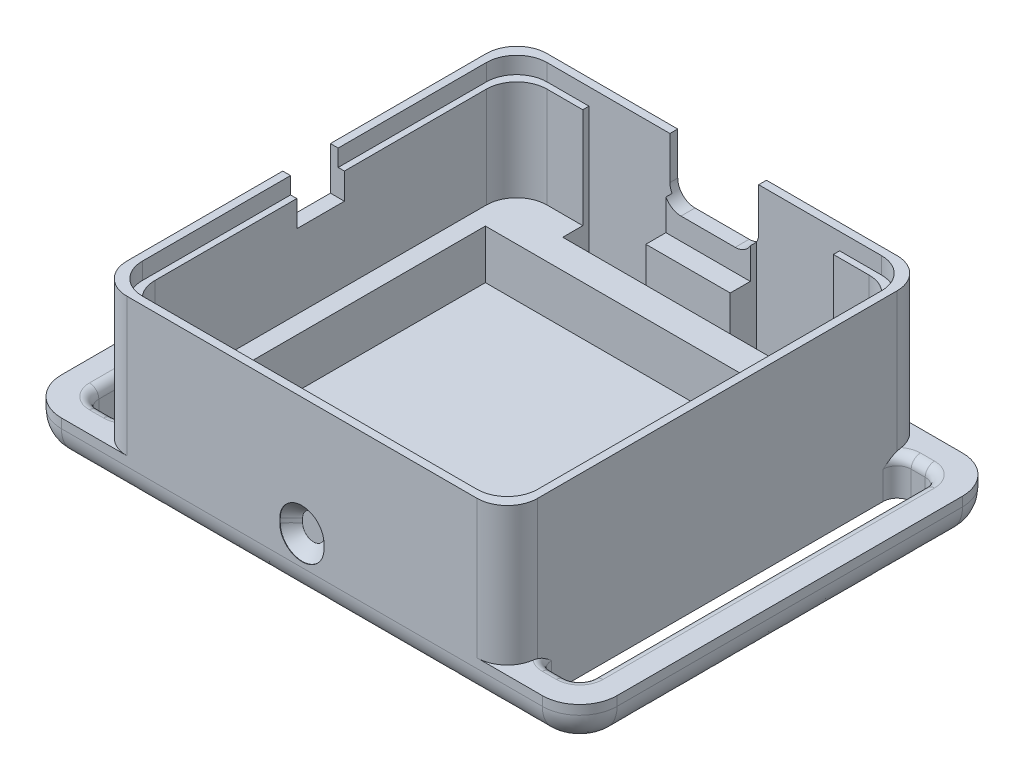
from build123d import *

# Parameters (mm, degrees)
BOTTOM_BASE_SKETCH_W                          = 44
BOTTOM_BASE_SKETCH_H                          = 45
BOTTOM_BASE_DEPTH                             = 1
SIDE_WALLS_SKETCH_W                           = 44
SIDE_WALLS_SKETCH_H                           = 45
SIDE_WALLS_SKETCH_W_2                         = 41
SIDE_WALLS_SKETCH_H_2                         = 42
SIDE_WALLS_DEPTH                              = 17.8
TOP_START                                     = -1.8
TOP_PLATE_SHOULDER_SKETCH_W                   = 42.333333334
TOP_PLATE_SHOULDER_SKETCH_H                   = 43.333333334
TOP_PLATE_SHOULDER_SKETCH_W_2                 = 41
TOP_PLATE_SHOULDER_SKETCH_H_2                 = 42
TOP_PLATE_SHOULDER_DEPTH                      = 1.8
STRAP_BRACKET_DEPTH                           = 4
CASE_FILLET_R                                 = 3.25
INNER_STRAP_BRACKET_FILLETS_R                 = 1.5
OUTER_STRAP_BRACKET_FILLETS_R                 = 4
USB_PORT_HOLE_REACH                           = 59.127
SWITCH_HOLE_REACH                             = 61.479
SWITCH_HOLE_SKETCH_W                          = 5.1
SWITCH_HOLE_SKETCH_H                          = 4.6
BATTERY_START                                 = 5.25
BATTERY_COMPARTMENT_SKETCH_W                  = 37.2
BATTERY_COMPARTMENT_SKETCH_H                  = 31.5
BATTERY_COMPARTMENT_DEPTH                     = 5.25
COMFORT_FILLET_SIZE                           = 2.5
COMFORT_FILLET_SIZE_2                         = 3
STRAP_FILLET_R                                = 1
CLIP_HOLE_SKETCH_W                            = 8.9
CLIP_HOLE_SKETCH_H                            = 2.813566806
CLIP_HOLE_DEPTH                               = 42.770234788
CLIP_HOLDER_DEPTH                             = 8.9
CLIP_MIRROR_AT_THE_SECOND_PLANE_COPY_1_S_W    = 8.9
CLIP_MIRROR_AT_THE_SECOND_PLANE_COPY_1_S_H    = 2.813566806
CLIP_MIRROR_AT_THE_SECOND_PLANE_COPY_1_DEPTH  = 42.770234788
CLIP_MIRROR_AT_THE_SECOND_PLANE_COPY_2_DEPTH  = 8.9
MIDDLE_REINFORCEMENT_SKETCH_W                 = 9.04
MIDDLE_REINFORCEMENT_SKETCH_H                 = 2.146900139
MIDDLE_REINFORCEMENT_DEPTH                    = 3.8
CLIP_BUTTON_HOLE_DEPTH                        = 1.25
CLIP_BUTTON_HOLE_FILLET_SIZE                  = 1.2
CLIP_BUTTON_HOLE_FILLET_OF_CLIP_BUTTON_H_SIZE = 1.2


with BuildPart() as part:
    # Bottom base Sketch → Bottom base (new body)
    with BuildSketch(Plane(origin=(0, 0, 0), x_dir=(1, 0, 0), z_dir=(0, 1, 0))):
        Rectangle(BOTTOM_BASE_SKETCH_W, BOTTOM_BASE_SKETCH_H)
    extrude(amount=BOTTOM_BASE_DEPTH)

    # Side walls sketch → Side walls (add)
    with BuildSketch(Plane(origin=(0, 1, 0), x_dir=(1, 0, 0), z_dir=(0, 1, 0))):
        Rectangle(SIDE_WALLS_SKETCH_W, SIDE_WALLS_SKETCH_H)
        Rectangle(SIDE_WALLS_SKETCH_W_2, SIDE_WALLS_SKETCH_H_2, mode=Mode.SUBTRACT)
    extrude(amount=SIDE_WALLS_DEPTH)

    # Top plate shoulder sketch → Top plate shoulder (cut)
    with BuildSketch(Plane(origin=(0, 18.8, 0), x_dir=(1, 0, 0), z_dir=(0, 1, 0)).offset(TOP_START)):
        Rectangle(TOP_PLATE_SHOULDER_SKETCH_W, TOP_PLATE_SHOULDER_SKETCH_H)
        Rectangle(TOP_PLATE_SHOULDER_SKETCH_W_2, TOP_PLATE_SHOULDER_SKETCH_H_2, mode=Mode.SUBTRACT)
    extrude(amount=TOP_PLATE_SHOULDER_DEPTH, mode=Mode.SUBTRACT)

    # Strap Bracket Sketch → Strap Bracket (add)
    with BuildSketch(Plane.XZ):
        Polygon((22, -19.25), (22, -22.5), (29.75, -22.5), (29.75, 22.5), (22, 22.5), (22, 19.25), (26.5, 19.25), (26.5, -19.25), align=None)
        Polygon((-29.75, 22.5), (-29.75, -22.5), (-22, -22.5), (-22, -19.25), (-26.5, -19.25), (-26.5, 19.25), (-22, 19.25), (-22, 22.5), align=None)
    extrude(amount=-STRAP_BRACKET_DEPTH)

    # Case fillet
    case_fillet_edges = [part.edges().sort_by_distance(p)[0] for p in [
        (22, 11.4, 22.5),
        (-22, 11.4, 22.5),
        (21.166666667, 17.9, 21.666666667),
        (-21.166666667, 17.9, 21.666666667),
        (-20.5, 9, 21),
        (20.5, 9, 21),
        (-21.166666667, 17.9, -21.666666667),
        (-20.5, 9, -21),
        (-22, 11.4, -22.5),
        (21.166666667, 17.9, -21.666666667),
        (20.5, 9, -21),
        (22, 11.4, -22.5),
    ]]
    fillet(case_fillet_edges, radius=CASE_FILLET_R)

    # Inner Strap Bracket Fillets
    inner_strap_bracket_fillets_edges = [part.edges().sort_by_distance(p)[0] for p in [
        (22, 2, 19.25),
        (22, 2, -19.25),
        (26.5, 2, -19.25),
        (26.5, 2, 19.25),
        (-26.5, 2, 19.25),
        (-26.5, 2, -19.25),
        (-22, 2, -19.25),
        (-22, 2, 19.25),
    ]]
    fillet(inner_strap_bracket_fillets_edges, radius=INNER_STRAP_BRACKET_FILLETS_R)

    # Outer Strap Bracket Fillets
    outer_strap_bracket_fillets_edges = [part.edges().sort_by_distance(p)[0] for p in [
        (29.75, 2, 22.5),
        (29.75, 2, -22.5),
        (-29.75, 2, -22.5),
        (-29.75, 2, 22.5),
    ]]
    fillet(outer_strap_bracket_fillets_edges, radius=OUTER_STRAP_BRACKET_FILLETS_R)

    # USB Port Hole: up to this face of the body (flat: up to its plane)
    usb_port_hole_end = Plane(part.part.faces().sort_by_distance((0, 9, -21))[0])
    # USB Port Hole Sketch → USB Port Hole (cut, up to the picked face)
    with BuildSketch(Plane(origin=(0, 0, -22.5), x_dir=(-1, 0, 0), z_dir=(0, 0, -1)), mode=Mode.PRIVATE) as usb_port_hole_sk1:
        with BuildLine():
            Line((-4.75, 18.8), (-4.75, 14.25))
            ThreePointArc((-4.75, 14.25), (-4.208147545, 12.941852455), (-2.9, 12.4))
            Line((-2.9, 12.4), (2.9, 12.4))
            ThreePointArc((2.9, 12.4), (4.208147545, 12.941852455), (4.75, 14.25))
            Line((4.75, 14.25), (4.75, 18.8))
            Line((4.75, 18.8), (-4.75, 18.8))
        make_face()
    usb_port_hole_tool1 = split(extrude(usb_port_hole_sk1.sketch, amount=-USB_PORT_HOLE_REACH, mode=Mode.PRIVATE), bisect_by=usb_port_hole_end, keep=Keep.BOTH, mode=Mode.PRIVATE)
    add(usb_port_hole_tool1.solids().sort_by(Axis((0, 15.668996, -22.5), (0, 0, 1)))[0], mode=Mode.SUBTRACT)

    # Switch Hole: up to this face of the body (flat: up to its plane)
    switch_hole_end = Plane(part.part.faces().sort_by_distance((-20.5, 9, 0))[0])
    # Switch Hole Sketch → Switch Hole (cut, up to the picked face)
    with BuildSketch(Plane.ZY.offset(22), mode=Mode.PRIVATE) as switch_hole_sk1:
        with Locations((0, 16.5)):
            Rectangle(SWITCH_HOLE_SKETCH_W, SWITCH_HOLE_SKETCH_H)
    switch_hole_tool1 = split(extrude(switch_hole_sk1.sketch, amount=-SWITCH_HOLE_REACH, mode=Mode.PRIVATE), bisect_by=switch_hole_end, keep=Keep.BOTH, mode=Mode.PRIVATE)
    add(switch_hole_tool1.solids().sort_by(Axis((-22, 16.5, 0), (1, 0, 0)))[0], mode=Mode.SUBTRACT)

    # Battery Compartment sketch → Battery Compartment (add)
    with BuildSketch(Plane(origin=(0, 1, 0), x_dir=(1, 0, 0), z_dir=(0, 1, 0)).offset(BATTERY_START)):
        with BuildLine():
            Line((-20.5, 17.75), (-20.5, -17.75))
            ThreePointArc((-20.5, -17.75), (-19.548097039, -20.048097039), (-17.25, -21))
            Line((-17.25, -21), (17.25, -21))
            ThreePointArc((17.25, -21), (19.548097039, -20.048097039), (20.5, -17.75))
            Line((20.5, -17.75), (20.5, 17.75))
            ThreePointArc((20.5, 17.75), (19.548097039, 20.048097039), (17.25, 21))
            Line((17.25, 21), (-17.25, 21))
            ThreePointArc((-17.25, 21), (-19.548097039, 20.048097039), (-20.5, 17.75))
        make_face()
        Rectangle(BATTERY_COMPARTMENT_SKETCH_W, BATTERY_COMPARTMENT_SKETCH_H, mode=Mode.SUBTRACT)
    extrude(amount=-BATTERY_COMPARTMENT_DEPTH)

    # Comfort Fillet
    # a fillet whose section is not a circle: 3, 2.5 mm, written as the material it takes off along each edge
    with BuildSketch(Plane(origin=(25.75, 0, -18.5), x_dir=(0, 0, -1), z_dir=(-1, 0, 0))) as comfort_fillet_piece_1:
        with BuildLine():
            Bezier((4 - COMFORT_FILLET_SIZE, 0), (4, 0), (4, -COMFORT_FILLET_SIZE_2), weights=[1, 0.707106781, 1])
            Line((4, -COMFORT_FILLET_SIZE_2), (4, 0))
            Line((4, 0), (4 - COMFORT_FILLET_SIZE, 0))
        make_face()
    revolve(axis=Axis((25.75, 0, -18.5), (0, -1, 0)), revolution_arc=90, mode=Mode.SUBTRACT)
    with BuildSketch(Plane(origin=(29.75, 0, -18.5), x_dir=(-1, 0, 0), z_dir=(0, 0, 1)), Plane(origin=(-29.75, 0, 18.5), x_dir=(1, 0, 0), z_dir=(0, 0, -1))) as comfort_fillet_piece_2:
        with BuildLine():
            Bezier((COMFORT_FILLET_SIZE, 0), (0, 0), (0, -COMFORT_FILLET_SIZE_2), weights=[1, 0.707106781, 1])
            Line((0, -COMFORT_FILLET_SIZE_2), (0, 0))
            Line((0, 0), (COMFORT_FILLET_SIZE, 0))
        make_face()
    extrude(amount=37, mode=Mode.SUBTRACT)
    with BuildSketch(Plane(origin=(25.75, 0, 18.5), x_dir=(1, 0, 0), z_dir=(0, 0, -1))) as comfort_fillet_piece_3:
        with BuildLine():
            Bezier((4 - COMFORT_FILLET_SIZE, 0), (4, 0), (4, -COMFORT_FILLET_SIZE_2), weights=[1, 0.707106781, 1])
            Line((4, -COMFORT_FILLET_SIZE_2), (4, 0))
            Line((4, 0), (4 - COMFORT_FILLET_SIZE, 0))
        make_face()
    revolve(axis=Axis((25.75, 0, 18.5), (0, -1, 0)), revolution_arc=90, mode=Mode.SUBTRACT)
    with BuildSketch(Plane(origin=(25.75, 0, 22.5), x_dir=(0, 0, -1), z_dir=(-1, 0, 0))) as comfort_fillet_piece_4:
        with BuildLine():
            Bezier((COMFORT_FILLET_SIZE, 0), (0, 0), (0, -COMFORT_FILLET_SIZE_2), weights=[1, 0.707106781, 1])
            Line((0, -COMFORT_FILLET_SIZE_2), (0, 0))
            Line((0, 0), (COMFORT_FILLET_SIZE, 0))
        make_face()
    extrude(amount=51.5, mode=Mode.SUBTRACT)
    with BuildSketch(Plane(origin=(-25.75, 0, 18.5), x_dir=(0, 0, 1), z_dir=(1, 0, 0))) as comfort_fillet_piece_5:
        with BuildLine():
            Bezier((4 - COMFORT_FILLET_SIZE, 0), (4, 0), (4, -COMFORT_FILLET_SIZE_2), weights=[1, 0.707106781, 1])
            Line((4, -COMFORT_FILLET_SIZE_2), (4, 0))
            Line((4, 0), (4 - COMFORT_FILLET_SIZE, 0))
        make_face()
    revolve(axis=Axis((-25.75, 0, 18.5), (0, -1, 0)), revolution_arc=90, mode=Mode.SUBTRACT)
    with BuildSketch(Plane(origin=(-25.75, 0, -18.5), x_dir=(0, 0, -1), z_dir=(1, 0, 0))) as comfort_fillet_piece_6:
        with BuildLine():
            Bezier((4 - COMFORT_FILLET_SIZE, 0), (4, 0), (4, COMFORT_FILLET_SIZE_2), weights=[1, 0.707106781, 1])
            Line((4, COMFORT_FILLET_SIZE_2), (4, 0))
            Line((4, 0), (4 - COMFORT_FILLET_SIZE, 0))
        make_face()
    revolve(axis=Axis((-25.75, 0, -18.5), (0, 1, 0)), revolution_arc=90, mode=Mode.SUBTRACT)
    with BuildSketch(Plane(origin=(25.75, 0, -22.5), x_dir=(0, 0, 1), z_dir=(-1, 0, 0))) as comfort_fillet_piece_7:
        with BuildLine():
            Bezier((COMFORT_FILLET_SIZE, 0), (0, 0), (0, COMFORT_FILLET_SIZE_2), weights=[1, 0.707106781, 1])
            Line((0, COMFORT_FILLET_SIZE_2), (0, 0))
            Line((0, 0), (COMFORT_FILLET_SIZE, 0))
        make_face()
    extrude(amount=51.5, mode=Mode.SUBTRACT)

    # Strap Fillet
    # the kernel refuses this fillet: 1 mm, written as the material it takes off along each edge
    with BuildSketch(Plane(origin=(-23.5, 4, 17.75), x_dir=(-0.09638996566753387, 0, -0.9953436464450918), z_dir=(-0.9953436464450918, 0, 0.09638996566753387))) as strap_fillet_piece_1_section:
        with BuildLine():
            CenterArc((1.5 + STRAP_FILLET_R, STRAP_FILLET_R), STRAP_FILLET_R, 180, 90)
            Line((1.5 + STRAP_FILLET_R, 0), (1.5, 0))
            Line((1.5, 0), (1.5, STRAP_FILLET_R))
        make_face()
    strap_fillet_piece_1 = revolve(axis=Axis((-23.5, 4, 17.75), (0, -1, 0)), revolution_arc=185.531326158, mode=Mode.PRIVATE)
    strap_fillet_piece_1 = split(strap_fillet_piece_1, bisect_by=Plane(origin=(-22, 4, 17.75), z_dir=(-1, 0, 0)), keep=Keep.TOP, mode=Mode.PRIVATE)
    add(strap_fillet_piece_1, mode=Mode.SUBTRACT)
    with BuildSketch(Plane(origin=(-23.5, 4, 17.75), x_dir=(-0.09638996566753387, 0, -0.9953436464450918), z_dir=(-0.9953436464450918, 0, 0.09638996566753387))) as strap_fillet_piece_2_section:
        with BuildLine():
            CenterArc((1.5 + STRAP_FILLET_R, STRAP_FILLET_R), STRAP_FILLET_R, 180, 90)
            Line((1.5 + STRAP_FILLET_R, 0), (1.5, 0))
            Line((1.5, 0), (1.5, STRAP_FILLET_R))
        make_face()
    strap_fillet_piece_2 = revolve(axis=Axis((-23.5, 4, 17.75), (0, -1, 0)), revolution_arc=185.531326158, mode=Mode.PRIVATE)
    strap_fillet_piece_2 = split(strap_fillet_piece_2, bisect_by=Plane(origin=(-23.5, 4, 19.25), z_dir=(0, 0, 1)), keep=Keep.TOP, mode=Mode.PRIVATE)
    strap_fillet_piece_2 = strap_fillet_piece_2 - Plane(origin=(-18.75, 4, 19.25), x_dir=(0, 0, 1), z_dir=(0, 1, 0)) * Cylinder(3.25, 10, mode=Mode.PRIVATE)
    add(strap_fillet_piece_2, mode=Mode.SUBTRACT)
    with BuildSketch(Plane(origin=(-25, 4, 19.25), x_dir=(0, -1, 0), z_dir=(1, 0, 0)), Plane(origin=(-23.5, 4, -19.25), x_dir=(0, -1, 0), z_dir=(-1, 0, 0)), Plane(origin=(23.5, 4, 19.25), x_dir=(0, -1, 0), z_dir=(1, 0, 0)), Plane(origin=(25, 4, -19.25), x_dir=(0, -1, 0), z_dir=(-1, 0, 0))) as strap_fillet_piece_3:
        with BuildLine():
            CenterArc((STRAP_FILLET_R, -STRAP_FILLET_R), STRAP_FILLET_R, 90, 90)
            Line((0, -STRAP_FILLET_R), (0, 0))
            Line((0, 0), (STRAP_FILLET_R, 0))
        make_face()
    extrude(amount=1.5, mode=Mode.SUBTRACT)
    with BuildSketch(Plane(origin=(-25, 4, 17.75), x_dir=(0, 0, 1), z_dir=(1, 0, 0))) as strap_fillet_piece_4:
        with BuildLine():
            CenterArc((1.5 + STRAP_FILLET_R, STRAP_FILLET_R), STRAP_FILLET_R, 180, 90)
            Line((1.5 + STRAP_FILLET_R, 0), (1.5, 0))
            Line((1.5, 0), (1.5, STRAP_FILLET_R))
        make_face()
    revolve(axis=Axis((-25, 4, 17.75), (0, -1, 0)), revolution_arc=90, mode=Mode.SUBTRACT)
    with BuildSketch(Plane(origin=(-23.5, 4, -17.75), x_dir=(-0.09638996566753152, 0, 0.9953436464450919), z_dir=(-0.9953436464450919, 0, -0.09638996566753152))) as strap_fillet_piece_5_section:
        with BuildLine():
            CenterArc((1.5 + STRAP_FILLET_R, -STRAP_FILLET_R), STRAP_FILLET_R, 90, 90)
            Line((1.5 + STRAP_FILLET_R, 0), (1.5, 0))
            Line((1.5, 0), (1.5, -STRAP_FILLET_R))
        make_face()
    strap_fillet_piece_5 = revolve(axis=Axis((-23.5, 4, -17.75), (0, 1, 0)), revolution_arc=185.531326158, mode=Mode.PRIVATE)
    strap_fillet_piece_5 = split(strap_fillet_piece_5, bisect_by=Plane(origin=(-22, 4, -17.75), z_dir=(-1, 0, 0)), keep=Keep.TOP, mode=Mode.PRIVATE)
    add(strap_fillet_piece_5, mode=Mode.SUBTRACT)
    with BuildSketch(Plane(origin=(-23.5, 4, -17.75), x_dir=(-0.09638996566753152, 0, 0.9953436464450919), z_dir=(-0.9953436464450919, 0, -0.09638996566753152))) as strap_fillet_piece_6_section:
        with BuildLine():
            CenterArc((1.5 + STRAP_FILLET_R, -STRAP_FILLET_R), STRAP_FILLET_R, 90, 90)
            Line((1.5 + STRAP_FILLET_R, 0), (1.5, 0))
            Line((1.5, 0), (1.5, -STRAP_FILLET_R))
        make_face()
    strap_fillet_piece_6 = revolve(axis=Axis((-23.5, 4, -17.75), (0, 1, 0)), revolution_arc=185.531326158, mode=Mode.PRIVATE)
    strap_fillet_piece_6 = split(strap_fillet_piece_6, bisect_by=Plane(origin=(-23.5, 4, -19.25), z_dir=(0, 0, -1)), keep=Keep.TOP, mode=Mode.PRIVATE)
    strap_fillet_piece_6 = strap_fillet_piece_6 - Plane(origin=(-18.75, 4, -19.25), x_dir=(0, 0, -1), z_dir=(0, 1, 0)) * Cylinder(3.25, 10, mode=Mode.PRIVATE)
    add(strap_fillet_piece_6, mode=Mode.SUBTRACT)
    with BuildSketch(Plane(origin=(-25, 4, -17.75), x_dir=(-1, 0, 0), z_dir=(0, 0, 1))) as strap_fillet_piece_7:
        with BuildLine():
            CenterArc((1.5 + STRAP_FILLET_R, STRAP_FILLET_R), STRAP_FILLET_R, 180, 90)
            Line((1.5 + STRAP_FILLET_R, 0), (1.5, 0))
            Line((1.5, 0), (1.5, STRAP_FILLET_R))
        make_face()
    revolve(axis=Axis((-25, 4, -17.75), (0, -1, 0)), revolution_arc=90, mode=Mode.SUBTRACT)
    with BuildSketch(Plane(origin=(23.5, 4, 17.75), x_dir=(0.09638996566753387, 0, -0.9953436464450918), z_dir=(0.9953436464450918, 0, 0.09638996566753387))) as strap_fillet_piece_8_section:
        with BuildLine():
            CenterArc((1.5 + STRAP_FILLET_R, -STRAP_FILLET_R), STRAP_FILLET_R, 90, 90)
            Line((1.5 + STRAP_FILLET_R, 0), (1.5, 0))
            Line((1.5, 0), (1.5, -STRAP_FILLET_R))
        make_face()
    strap_fillet_piece_8 = revolve(axis=Axis((23.5, 4, 17.75), (0, 1, 0)), revolution_arc=185.531326158, mode=Mode.PRIVATE)
    strap_fillet_piece_8 = split(strap_fillet_piece_8, bisect_by=Plane(origin=(22, 4, 17.75), z_dir=(1, 0, 0)), keep=Keep.TOP, mode=Mode.PRIVATE)
    add(strap_fillet_piece_8, mode=Mode.SUBTRACT)
    with BuildSketch(Plane(origin=(23.5, 4, 17.75), x_dir=(0.09638996566753387, 0, -0.9953436464450918), z_dir=(0.9953436464450918, 0, 0.09638996566753387))) as strap_fillet_piece_9_section:
        with BuildLine():
            CenterArc((1.5 + STRAP_FILLET_R, -STRAP_FILLET_R), STRAP_FILLET_R, 90, 90)
            Line((1.5 + STRAP_FILLET_R, 0), (1.5, 0))
            Line((1.5, 0), (1.5, -STRAP_FILLET_R))
        make_face()
    strap_fillet_piece_9 = revolve(axis=Axis((23.5, 4, 17.75), (0, 1, 0)), revolution_arc=185.531326158, mode=Mode.PRIVATE)
    strap_fillet_piece_9 = split(strap_fillet_piece_9, bisect_by=Plane(origin=(23.5, 4, 19.25), z_dir=(0, 0, 1)), keep=Keep.TOP, mode=Mode.PRIVATE)
    strap_fillet_piece_9 = strap_fillet_piece_9 - Plane(origin=(18.75, 4, 19.25), x_dir=(0, 0, 1), z_dir=(0, -1, 0)) * Cylinder(3.25, 10, mode=Mode.PRIVATE)
    add(strap_fillet_piece_9, mode=Mode.SUBTRACT)
    with BuildSketch(Plane(origin=(25, 4, 17.75), x_dir=(1, 0, 0), z_dir=(0, 0, -1))) as strap_fillet_piece_10:
        with BuildLine():
            CenterArc((1.5 + STRAP_FILLET_R, STRAP_FILLET_R), STRAP_FILLET_R, 180, 90)
            Line((1.5 + STRAP_FILLET_R, 0), (1.5, 0))
            Line((1.5, 0), (1.5, STRAP_FILLET_R))
        make_face()
    revolve(axis=Axis((25, 4, 17.75), (0, -1, 0)), revolution_arc=90, mode=Mode.SUBTRACT)
    with BuildSketch(Plane(origin=(23.5, 4, -17.75), x_dir=(0.09638996566753152, 0, 0.9953436464450919), z_dir=(0.9953436464450919, 0, -0.09638996566753152))) as strap_fillet_piece_11_section:
        with BuildLine():
            CenterArc((1.5 + STRAP_FILLET_R, STRAP_FILLET_R), STRAP_FILLET_R, 180, 90)
            Line((1.5 + STRAP_FILLET_R, 0), (1.5, 0))
            Line((1.5, 0), (1.5, STRAP_FILLET_R))
        make_face()
    strap_fillet_piece_11 = revolve(axis=Axis((23.5, 4, -17.75), (0, -1, 0)), revolution_arc=185.531326158, mode=Mode.PRIVATE)
    strap_fillet_piece_11 = split(strap_fillet_piece_11, bisect_by=Plane(origin=(22, 4, -17.75), z_dir=(1, 0, 0)), keep=Keep.TOP, mode=Mode.PRIVATE)
    add(strap_fillet_piece_11, mode=Mode.SUBTRACT)
    with BuildSketch(Plane(origin=(23.5, 4, -17.75), x_dir=(0.09638996566753152, 0, 0.9953436464450919), z_dir=(0.9953436464450919, 0, -0.09638996566753152))) as strap_fillet_piece_12_section:
        with BuildLine():
            CenterArc((1.5 + STRAP_FILLET_R, STRAP_FILLET_R), STRAP_FILLET_R, 180, 90)
            Line((1.5 + STRAP_FILLET_R, 0), (1.5, 0))
            Line((1.5, 0), (1.5, STRAP_FILLET_R))
        make_face()
    strap_fillet_piece_12 = revolve(axis=Axis((23.5, 4, -17.75), (0, -1, 0)), revolution_arc=185.531326158, mode=Mode.PRIVATE)
    strap_fillet_piece_12 = split(strap_fillet_piece_12, bisect_by=Plane(origin=(23.5, 4, -19.25), z_dir=(0, 0, -1)), keep=Keep.TOP, mode=Mode.PRIVATE)
    strap_fillet_piece_12 = strap_fillet_piece_12 - Plane(origin=(18.75, 4, -19.25), x_dir=(0, 0, -1), z_dir=(0, -1, 0)) * Cylinder(3.25, 10, mode=Mode.PRIVATE)
    add(strap_fillet_piece_12, mode=Mode.SUBTRACT)
    with BuildSketch(Plane(origin=(25, 4, -17.75), x_dir=(0, 0, -1), z_dir=(-1, 0, 0))) as strap_fillet_piece_13:
        with BuildLine():
            CenterArc((1.5 + STRAP_FILLET_R, STRAP_FILLET_R), STRAP_FILLET_R, 180, 90)
            Line((1.5 + STRAP_FILLET_R, 0), (1.5, 0))
            Line((1.5, 0), (1.5, STRAP_FILLET_R))
        make_face()
    revolve(axis=Axis((25, 4, -17.75), (0, -1, 0)), revolution_arc=90, mode=Mode.SUBTRACT)
    with BuildSketch(Plane(origin=(-26.5, 4, -17.75), x_dir=(0, -1, 0), z_dir=(0, 0, 1)), Plane(origin=(26.5, 4, 17.75), x_dir=(0, -1, 0), z_dir=(0, 0, -1))) as strap_fillet_piece_14:
        with BuildLine():
            CenterArc((STRAP_FILLET_R, -STRAP_FILLET_R), STRAP_FILLET_R, 90, 90)
            Line((0, -STRAP_FILLET_R), (0, 0))
            Line((0, 0), (STRAP_FILLET_R, 0))
        make_face()
    extrude(amount=35.5, mode=Mode.SUBTRACT)

    # Clip hole sketch → Clip hole (cut, through all)
    with BuildSketch(Plane.XZ):
        with Locations((-8.97, 20.259883264)):
            Rectangle(CLIP_HOLE_SKETCH_W, CLIP_HOLE_SKETCH_H)
    clip_hole = extrude(amount=-CLIP_HOLE_DEPTH, mode=Mode.SUBTRACT)

    # Clip Holder Sketch → Clip Holder (add)
    with BuildSketch(Plane.ZY.offset(4.52)):
        with BuildLine():
            Line((18.853099861, 6.25), (18.853099861, 0))
            Line((18.853099861, 0), (19.35, 0))
            Line((19.35, 0), (19.35, 1.625))
            ThreePointArc((19.35, 1.625), (19.583101432, 2.373644609), (20.2, 2.857629304))
            ThreePointArc((20.2, 2.857629304), (19.850957779, 4.682616901), (18.853099861, 6.25))
        make_face()
    clip_holder = extrude(amount=CLIP_HOLDER_DEPTH)

    # Clip Mirror: Clip hole, Clip Holder across plane
    add(clip_hole.mirror(Plane(origin=(0, 0, 0), x_dir=(0, 0, 1), z_dir=(1, 0, 0))), mode=Mode.SUBTRACT)
    add(clip_holder.mirror(Plane(origin=(0, 0, 0), x_dir=(0, 0, 1), z_dir=(1, 0, 0))))

    # Clip Mirror at the second plane: Clip hole, Clip Holder across plane
    add(clip_hole.mirror(Plane.XY), mode=Mode.SUBTRACT)
    add(clip_holder.mirror(Plane.XY))

    # Clip Mirror at the second plane copy 1 s → Clip Mirror at the second plane copy 1 (cut, through all)
    with BuildSketch(Plane(origin=(0, 0, 0), x_dir=(-1, 0, 0), z_dir=(0, -1, 0))):
        with Locations((-8.97, 20.259883264)):
            Rectangle(CLIP_MIRROR_AT_THE_SECOND_PLANE_COPY_1_S_W, CLIP_MIRROR_AT_THE_SECOND_PLANE_COPY_1_S_H)
    extrude(amount=-CLIP_MIRROR_AT_THE_SECOND_PLANE_COPY_1_DEPTH, mode=Mode.SUBTRACT)

    # Clip Mirror at the second plane copy 2 s → Clip Mirror at the second plane copy 2 (add)
    with BuildSketch(Plane(origin=(4.52, 0, 0), x_dir=(0, 0, -1), z_dir=(1, 0, 0))):
        with BuildLine():
            Line((18.853099861, 6.25), (18.853099861, 0))
            Line((18.853099861, 0), (19.35, 0))
            Line((19.35, 0), (19.35, 1.625))
            ThreePointArc((19.35, 1.625), (19.583101432, 2.373644609), (20.2, 2.857629304))
            ThreePointArc((20.2, 2.857629304), (19.850957779, 4.682616901), (18.853099861, 6.25))
        make_face()
    extrude(amount=CLIP_MIRROR_AT_THE_SECOND_PLANE_COPY_2_DEPTH)

    # Middle Reinforcement Sketch → Middle Reinforcement (add)
    with BuildSketch(Plane(origin=(0, 6.25, 0), x_dir=(1, 0, 0), z_dir=(0, 1, 0))):
        with Locations((0, -19.926549931)):
            Rectangle(MIDDLE_REINFORCEMENT_SKETCH_W, MIDDLE_REINFORCEMENT_SKETCH_H)
        with Locations((0, 19.926549931)):
            Rectangle(MIDDLE_REINFORCEMENT_SKETCH_W, MIDDLE_REINFORCEMENT_SKETCH_H)
    extrude(amount=MIDDLE_REINFORCEMENT_DEPTH)

    # Clip Button Hole Sketch → Clip Button Hole (cut)
    with BuildSketch(Plane(origin=(0, 0, -22.5), x_dir=(-1, 0, 0), z_dir=(0, 0, -1))):
        with BuildLine():
            Line((-2.37, 5.92), (-2.37, 6.38))
            ThreePointArc((-2.37, 6.38), (0, 8.75), (2.37, 6.38))
            Line((2.37, 6.38), (2.37, 5.92))
            ThreePointArc((2.37, 5.92), (0, 3.55), (-2.37, 5.92))
        make_face()
    clip_button_hole = extrude(amount=-CLIP_BUTTON_HOLE_DEPTH, mode=Mode.SUBTRACT)

    # Clip Button Hole Fillet
    # a fillet whose section is not a circle: 1.2 mm, written as the material it adds along each edge
    with BuildSketch(Plane(origin=(2.37, 5.92, -21.25), x_dir=(0, 0, -1), z_dir=(0, 1, 0)), Plane(origin=(-2.37, 6.38, -21.25), x_dir=(0, 0, -1), z_dir=(0, -1, 0))) as clip_button_hole_fillet_piece_1:
        with BuildLine():
            Bezier((CLIP_BUTTON_HOLE_FILLET_SIZE, 0), (0, 0), (0, CLIP_BUTTON_HOLE_FILLET_SIZE), weights=[1, 0.052631579, 1])
            Line((0, CLIP_BUTTON_HOLE_FILLET_SIZE), (-CLIP_BUTTON_HOLE_FILLET_SIZE * 0.02, CLIP_BUTTON_HOLE_FILLET_SIZE))
            Line((-CLIP_BUTTON_HOLE_FILLET_SIZE * 0.02, CLIP_BUTTON_HOLE_FILLET_SIZE), (-CLIP_BUTTON_HOLE_FILLET_SIZE * 0.02, -CLIP_BUTTON_HOLE_FILLET_SIZE * 0.02))
            Line((-CLIP_BUTTON_HOLE_FILLET_SIZE * 0.02, -CLIP_BUTTON_HOLE_FILLET_SIZE * 0.02), (CLIP_BUTTON_HOLE_FILLET_SIZE, -CLIP_BUTTON_HOLE_FILLET_SIZE * 0.02))
            Line((CLIP_BUTTON_HOLE_FILLET_SIZE, -CLIP_BUTTON_HOLE_FILLET_SIZE * 0.02), (CLIP_BUTTON_HOLE_FILLET_SIZE, 0))
        make_face()
    extrude(amount=0.46)
    with BuildSketch(Plane(origin=(0, 6.38, -21.25), x_dir=(1, 0, 0), z_dir=(0, -1, 0))) as clip_button_hole_fillet_piece_2:
        with BuildLine():
            Bezier((2.37, -CLIP_BUTTON_HOLE_FILLET_SIZE), (2.37, 0), (2.37 - CLIP_BUTTON_HOLE_FILLET_SIZE, 0), weights=[1, 0.052631579, 1])
            Line((2.37 - CLIP_BUTTON_HOLE_FILLET_SIZE, 0), (2.37 - CLIP_BUTTON_HOLE_FILLET_SIZE, CLIP_BUTTON_HOLE_FILLET_SIZE * 0.02))
            Line((2.37 - CLIP_BUTTON_HOLE_FILLET_SIZE, CLIP_BUTTON_HOLE_FILLET_SIZE * 0.02), (2.37 + CLIP_BUTTON_HOLE_FILLET_SIZE * 0.02, CLIP_BUTTON_HOLE_FILLET_SIZE * 0.02))
            Line((2.37 + CLIP_BUTTON_HOLE_FILLET_SIZE * 0.02, CLIP_BUTTON_HOLE_FILLET_SIZE * 0.02), (2.37 + CLIP_BUTTON_HOLE_FILLET_SIZE * 0.02, -CLIP_BUTTON_HOLE_FILLET_SIZE))
            Line((2.37 + CLIP_BUTTON_HOLE_FILLET_SIZE * 0.02, -CLIP_BUTTON_HOLE_FILLET_SIZE), (2.37, -CLIP_BUTTON_HOLE_FILLET_SIZE))
        make_face()
    revolve(axis=Axis((0, 6.38, -21.25), (0, 0, 1)), revolution_arc=180)
    with BuildSketch(Plane(origin=(0, 5.92, -21.25), x_dir=(-1, 0, 0), z_dir=(0, 1, 0))) as clip_button_hole_fillet_piece_3:
        with BuildLine():
            Bezier((2.37, -CLIP_BUTTON_HOLE_FILLET_SIZE), (2.37, 0), (2.37 - CLIP_BUTTON_HOLE_FILLET_SIZE, 0), weights=[1, 0.052631579, 1])
            Line((2.37 - CLIP_BUTTON_HOLE_FILLET_SIZE, 0), (2.37 - CLIP_BUTTON_HOLE_FILLET_SIZE, CLIP_BUTTON_HOLE_FILLET_SIZE * 0.02))
            Line((2.37 - CLIP_BUTTON_HOLE_FILLET_SIZE, CLIP_BUTTON_HOLE_FILLET_SIZE * 0.02), (2.37 + CLIP_BUTTON_HOLE_FILLET_SIZE * 0.02, CLIP_BUTTON_HOLE_FILLET_SIZE * 0.02))
            Line((2.37 + CLIP_BUTTON_HOLE_FILLET_SIZE * 0.02, CLIP_BUTTON_HOLE_FILLET_SIZE * 0.02), (2.37 + CLIP_BUTTON_HOLE_FILLET_SIZE * 0.02, -CLIP_BUTTON_HOLE_FILLET_SIZE))
            Line((2.37 + CLIP_BUTTON_HOLE_FILLET_SIZE * 0.02, -CLIP_BUTTON_HOLE_FILLET_SIZE), (2.37, -CLIP_BUTTON_HOLE_FILLET_SIZE))
        make_face()
    revolve(axis=Axis((0, 5.92, -21.25), (0, 0, 1)), revolution_arc=180)

    # Clip Button Hole Mirror: Clip Button Hole across plane
    add(clip_button_hole.mirror(Plane.XY), mode=Mode.SUBTRACT)

    # Clip Button Hole Fillet of Clip Button H
    # a fillet whose section is not a circle: 1.2 mm, written as the material it adds along each edge
    with BuildSketch(Plane(origin=(2.37, 5.92, 21.25), x_dir=(0, 0, 1), z_dir=(0, 1, 0)), Plane(origin=(-2.37, 6.38, 21.25), x_dir=(0, 0, 1), z_dir=(0, -1, 0))) as clip_button_hole_fillet_of_clip_button_h_piece_1:
        with BuildLine():
            Bezier((CLIP_BUTTON_HOLE_FILLET_OF_CLIP_BUTTON_H_SIZE, 0), (0, 0), (0, -CLIP_BUTTON_HOLE_FILLET_OF_CLIP_BUTTON_H_SIZE), weights=[1, 0.052631579, 1])
            Line((0, -CLIP_BUTTON_HOLE_FILLET_OF_CLIP_BUTTON_H_SIZE), (-CLIP_BUTTON_HOLE_FILLET_OF_CLIP_BUTTON_H_SIZE * 0.02, -CLIP_BUTTON_HOLE_FILLET_OF_CLIP_BUTTON_H_SIZE))
            Line((-CLIP_BUTTON_HOLE_FILLET_OF_CLIP_BUTTON_H_SIZE * 0.02, -CLIP_BUTTON_HOLE_FILLET_OF_CLIP_BUTTON_H_SIZE), (-CLIP_BUTTON_HOLE_FILLET_OF_CLIP_BUTTON_H_SIZE * 0.02, CLIP_BUTTON_HOLE_FILLET_OF_CLIP_BUTTON_H_SIZE * 0.02))
            Line((-CLIP_BUTTON_HOLE_FILLET_OF_CLIP_BUTTON_H_SIZE * 0.02, CLIP_BUTTON_HOLE_FILLET_OF_CLIP_BUTTON_H_SIZE * 0.02), (CLIP_BUTTON_HOLE_FILLET_OF_CLIP_BUTTON_H_SIZE, CLIP_BUTTON_HOLE_FILLET_OF_CLIP_BUTTON_H_SIZE * 0.02))
            Line((CLIP_BUTTON_HOLE_FILLET_OF_CLIP_BUTTON_H_SIZE, CLIP_BUTTON_HOLE_FILLET_OF_CLIP_BUTTON_H_SIZE * 0.02), (CLIP_BUTTON_HOLE_FILLET_OF_CLIP_BUTTON_H_SIZE, 0))
        make_face()
    extrude(amount=0.46)
    with BuildSketch(Plane(origin=(0, 6.38, 21.25), x_dir=(1, 0, 0), z_dir=(0, -1, 0))) as clip_button_hole_fillet_of_clip_button_h_piece_2:
        with BuildLine():
            Bezier((2.37, CLIP_BUTTON_HOLE_FILLET_OF_CLIP_BUTTON_H_SIZE), (2.37, 0), (2.37 - CLIP_BUTTON_HOLE_FILLET_OF_CLIP_BUTTON_H_SIZE, 0), weights=[1, 0.052631579, 1])
            Line((2.37 - CLIP_BUTTON_HOLE_FILLET_OF_CLIP_BUTTON_H_SIZE, 0), (2.37 - CLIP_BUTTON_HOLE_FILLET_OF_CLIP_BUTTON_H_SIZE, -CLIP_BUTTON_HOLE_FILLET_OF_CLIP_BUTTON_H_SIZE * 0.02))
            Line((2.37 - CLIP_BUTTON_HOLE_FILLET_OF_CLIP_BUTTON_H_SIZE, -CLIP_BUTTON_HOLE_FILLET_OF_CLIP_BUTTON_H_SIZE * 0.02), (2.37 + CLIP_BUTTON_HOLE_FILLET_OF_CLIP_BUTTON_H_SIZE * 0.02, -CLIP_BUTTON_HOLE_FILLET_OF_CLIP_BUTTON_H_SIZE * 0.02))
            Line((2.37 + CLIP_BUTTON_HOLE_FILLET_OF_CLIP_BUTTON_H_SIZE * 0.02, -CLIP_BUTTON_HOLE_FILLET_OF_CLIP_BUTTON_H_SIZE * 0.02), (2.37 + CLIP_BUTTON_HOLE_FILLET_OF_CLIP_BUTTON_H_SIZE * 0.02, CLIP_BUTTON_HOLE_FILLET_OF_CLIP_BUTTON_H_SIZE))
            Line((2.37 + CLIP_BUTTON_HOLE_FILLET_OF_CLIP_BUTTON_H_SIZE * 0.02, CLIP_BUTTON_HOLE_FILLET_OF_CLIP_BUTTON_H_SIZE), (2.37, CLIP_BUTTON_HOLE_FILLET_OF_CLIP_BUTTON_H_SIZE))
        make_face()
    revolve(axis=Axis((0, 6.38, 21.25), (0, 0, 1)), revolution_arc=180)
    with BuildSketch(Plane(origin=(0, 5.92, 21.25), x_dir=(-1, 0, 0), z_dir=(0, 1, 0))) as clip_button_hole_fillet_of_clip_button_h_piece_3:
        with BuildLine():
            Bezier((2.37, CLIP_BUTTON_HOLE_FILLET_OF_CLIP_BUTTON_H_SIZE), (2.37, 0), (2.37 - CLIP_BUTTON_HOLE_FILLET_OF_CLIP_BUTTON_H_SIZE, 0), weights=[1, 0.052631579, 1])
            Line((2.37 - CLIP_BUTTON_HOLE_FILLET_OF_CLIP_BUTTON_H_SIZE, 0), (2.37 - CLIP_BUTTON_HOLE_FILLET_OF_CLIP_BUTTON_H_SIZE, -CLIP_BUTTON_HOLE_FILLET_OF_CLIP_BUTTON_H_SIZE * 0.02))
            Line((2.37 - CLIP_BUTTON_HOLE_FILLET_OF_CLIP_BUTTON_H_SIZE, -CLIP_BUTTON_HOLE_FILLET_OF_CLIP_BUTTON_H_SIZE * 0.02), (2.37 + CLIP_BUTTON_HOLE_FILLET_OF_CLIP_BUTTON_H_SIZE * 0.02, -CLIP_BUTTON_HOLE_FILLET_OF_CLIP_BUTTON_H_SIZE * 0.02))
            Line((2.37 + CLIP_BUTTON_HOLE_FILLET_OF_CLIP_BUTTON_H_SIZE * 0.02, -CLIP_BUTTON_HOLE_FILLET_OF_CLIP_BUTTON_H_SIZE * 0.02), (2.37 + CLIP_BUTTON_HOLE_FILLET_OF_CLIP_BUTTON_H_SIZE * 0.02, CLIP_BUTTON_HOLE_FILLET_OF_CLIP_BUTTON_H_SIZE))
            Line((2.37 + CLIP_BUTTON_HOLE_FILLET_OF_CLIP_BUTTON_H_SIZE * 0.02, CLIP_BUTTON_HOLE_FILLET_OF_CLIP_BUTTON_H_SIZE), (2.37, CLIP_BUTTON_HOLE_FILLET_OF_CLIP_BUTTON_H_SIZE))
        make_face()
    revolve(axis=Axis((0, 5.92, 21.25), (0, 0, 1)), revolution_arc=180)


solid = part.part
